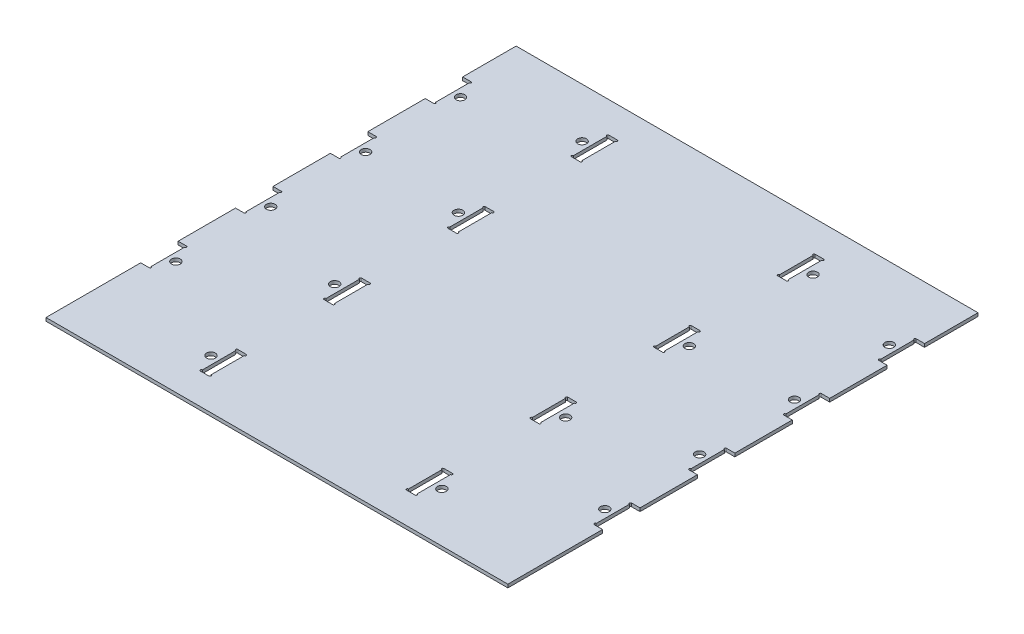
from build123d import *

# Parameters (mm, degrees)
SKETCH1_W               = 355.6
SKETCH1_H               = 361.95
BOSS_EXTRUDE1_DEPTH     = 2.54
F_1_4_CLEARANCE_HOLE1_D = 6.7564
SKETCH9_W               = 6.604
SKETCH9_H               = 28.829
SKETCH9_W_2             = 6.35
SKETCH9_H_2             = 28.575
CUT_EXTRUDE1_DEPTH      = 254.714883728
MIRROR1_OUTLINE_W       = 6.477
MIRROR1_OUTLINE_H       = 28.829
MIRROR1_OUTLINE_W_2     = 6.604
MIRROR1_OUTLINE_R       = 3.3782
MIRROR1_DEPTH           = 2.54
SKETCH10_R              = 0.79375
CUT_EXTRUDE2_DEPTH      = 254.714883728


# Read off the part's stored shape, not the designer's step: Mirror1
with BuildPart() as part:
    # Sketch1 → Boss-Extrude1 (new body)
    with BuildSketch(Plane(origin=(0, 0, 0), x_dir=(1, 0, 0), z_dir=(0, 1, 0))):
        Rectangle(SKETCH1_W, SKETCH1_H)
    extrude(amount=BOSS_EXTRUDE1_DEPTH)

    # 1/4 Clearance Hole1 (through all)
    with Locations(Plane(origin=(0, 2.54, 0), x_dir=(1, 0, 0), z_dir=(0, 1, 0))):
        with Locations((-165.1, 125.4125), (-88.9, 142.875), (-88.9, 47.625), (-165.1, 52.3875), (-165.1, -20.6375), (-88.9, -47.625), (-88.9, -142.875), (-165.1, -93.6625)):
            Hole(F_1_4_CLEARANCE_HOLE1_D / 2)

    # Sketch9 → Cut-Extrude1 (cut, through all)
    # profile 1 of 8: a face of its own
    with BuildSketch(Plane(origin=(0, 0, 0), x_dir=(-1, 0, 0), z_dir=(0, -1, 0))):
        with Locations((174.625, -93.6625)):
            Rectangle(SKETCH9_W, SKETCH9_H)
        with Locations((174.625, -93.6625)):
            Rectangle(SKETCH9_W_2, SKETCH9_H_2, mode=Mode.SUBTRACT)
    # profile 2 of 8: a face of its own
    with BuildSketch(Plane(origin=(0, 0, 0), x_dir=(-1, 0, 0), z_dir=(0, -1, 0))):
        with Locations((174.625, -20.6375)):
            Rectangle(SKETCH9_W, SKETCH9_H)
        with Locations((174.625, -20.6375)):
            Rectangle(SKETCH9_W_2, SKETCH9_H_2, mode=Mode.SUBTRACT)
    # profile 3 of 8: a face of its own
    with BuildSketch(Plane(origin=(0, 0, 0), x_dir=(-1, 0, 0), z_dir=(0, -1, 0))):
        with Locations((174.625, 52.3875)):
            Rectangle(SKETCH9_W, SKETCH9_H)
        with Locations((174.625, 52.3875)):
            Rectangle(SKETCH9_W_2, SKETCH9_H_2, mode=Mode.SUBTRACT)
    # profile 4 of 8: a face of its own
    with BuildSketch(Plane(origin=(0, 0, 0), x_dir=(-1, 0, 0), z_dir=(0, -1, 0))):
        with Locations((174.625, 125.4125)):
            Rectangle(SKETCH9_W, SKETCH9_H)
        with Locations((174.625, 125.4125)):
            Rectangle(SKETCH9_W_2, SKETCH9_H_2, mode=Mode.SUBTRACT)
    # profile 5 of 8: a face of its own
    with BuildSketch(Plane(origin=(0, 0, 0), x_dir=(-1, 0, 0), z_dir=(0, -1, 0))):
        with Locations((79.375, 142.875)):
            Rectangle(SKETCH9_W, SKETCH9_H)
        with Locations((79.375, 142.875)):
            Rectangle(SKETCH9_W_2, SKETCH9_H_2, mode=Mode.SUBTRACT)
    # profile 6 of 8: a face of its own
    with BuildSketch(Plane(origin=(0, 0, 0), x_dir=(-1, 0, 0), z_dir=(0, -1, 0))):
        with Locations((79.375, 47.625)):
            Rectangle(SKETCH9_W, SKETCH9_H)
        with Locations((79.375, 47.625)):
            Rectangle(SKETCH9_W_2, SKETCH9_H_2, mode=Mode.SUBTRACT)
    # profile 7 of 8: a face of its own
    with BuildSketch(Plane(origin=(0, 0, 0), x_dir=(-1, 0, 0), z_dir=(0, -1, 0))):
        with Locations((79.375, -47.625)):
            Rectangle(SKETCH9_W, SKETCH9_H)
        with Locations((79.375, -47.625)):
            Rectangle(SKETCH9_W_2, SKETCH9_H_2, mode=Mode.SUBTRACT)
    # profile 8 of 8: a face of its own
    with BuildSketch(Plane(origin=(0, 0, 0), x_dir=(-1, 0, 0), z_dir=(0, -1, 0))):
        with Locations((79.375, -142.875)):
            Rectangle(SKETCH9_W, SKETCH9_H)
        with Locations((79.375, -142.875)):
            Rectangle(SKETCH9_W_2, SKETCH9_H_2, mode=Mode.SUBTRACT)
    extrude(amount=-CUT_EXTRUDE1_DEPTH, mode=Mode.SUBTRACT)


with BuildPart() as cut_extrude1_kept_piece:
    # of the separate pieces the step leaves, the one the design keeps (cut_extrude1_pieces_kept)
    add(part.part.solids().sort_by_distance((-177.8, 0, -180.975))[0])

    # Mirror1 outline → Mirror1 (cut)
    with BuildSketch(Plane(origin=(0, 0, 0), x_dir=(1, 0, 0), z_dir=(0, 1, 0))):
        with Locations((174.5615, 125.4125)):
            Rectangle(MIRROR1_OUTLINE_W, MIRROR1_OUTLINE_H)
        with Locations((174.5615, 52.3875)):
            Rectangle(MIRROR1_OUTLINE_W, MIRROR1_OUTLINE_H)
        with Locations((174.5615, -20.6375)):
            Rectangle(MIRROR1_OUTLINE_W, MIRROR1_OUTLINE_H)
        with Locations((174.5615, -93.6625)):
            Rectangle(MIRROR1_OUTLINE_W, MIRROR1_OUTLINE_H)
        with Locations((79.375, 142.875)):
            Rectangle(MIRROR1_OUTLINE_W_2, MIRROR1_OUTLINE_H)
        with Locations((79.375, 47.625)):
            Rectangle(MIRROR1_OUTLINE_W_2, MIRROR1_OUTLINE_H)
        with Locations((79.375, -47.625)):
            Rectangle(MIRROR1_OUTLINE_W_2, MIRROR1_OUTLINE_H)
        with Locations((79.375, -142.875)):
            Rectangle(MIRROR1_OUTLINE_W_2, MIRROR1_OUTLINE_H)
        with Locations((165.1, -93.6625)):
            Circle(MIRROR1_OUTLINE_R)
        with Locations((88.9, -142.875)):
            Circle(MIRROR1_OUTLINE_R)
        with Locations((88.9, -47.625)):
            Circle(MIRROR1_OUTLINE_R)
        with Locations((165.1, -20.6375)):
            Circle(MIRROR1_OUTLINE_R)
        with Locations((165.1, 52.3875)):
            Circle(MIRROR1_OUTLINE_R)
        with Locations((88.9, 47.625)):
            Circle(MIRROR1_OUTLINE_R)
        with Locations((88.9, 142.875)):
            Circle(MIRROR1_OUTLINE_R)
        with Locations((165.1, 125.4125)):
            Circle(MIRROR1_OUTLINE_R)
    extrude(amount=MIRROR1_DEPTH, mode=Mode.SUBTRACT)

    # Sketch10 → Cut-Extrude2 (cut, through all)
    with BuildSketch(Plane(origin=(0, 2.54, 0), x_dir=(1, 0, 0), z_dir=(0, 1, 0))):
        with Locations((-171.323, 139.03325)):
            Circle(SKETCH10_R)
        with Locations((-171.323, 111.79175)):
            Circle(SKETCH10_R)
        with Locations((-171.323, 66.00825)):
            Circle(SKETCH10_R)
        with Locations((-171.323, 38.76675)):
            Circle(SKETCH10_R)
        with Locations((-82.677, 156.49575)):
            Circle(SKETCH10_R)
        with Locations((-76.073, 156.49575)):
            Circle(SKETCH10_R)
        with Locations((-76.073, 129.25425)):
            Circle(SKETCH10_R)
        with Locations((-82.677, 129.25425)):
            Circle(SKETCH10_R)
        with Locations((-82.677, 61.24575)):
            Circle(SKETCH10_R)
        with Locations((-76.073, 61.24575)):
            Circle(SKETCH10_R)
        with Locations((-76.073, 34.00425)):
            Circle(SKETCH10_R)
        with Locations((-82.677, 34.00425)):
            Circle(SKETCH10_R)
        with Locations((-171.323, -7.01675)):
            Circle(SKETCH10_R)
        with Locations((-171.323, -34.25825)):
            Circle(SKETCH10_R)
        with Locations((-82.677, -34.00425)):
            Circle(SKETCH10_R)
        with Locations((-76.073, -34.00425)):
            Circle(SKETCH10_R)
        with Locations((-76.073, -61.24575)):
            Circle(SKETCH10_R)
        with Locations((-82.677, -61.24575)):
            Circle(SKETCH10_R)
        with Locations((-171.323, -80.04175)):
            Circle(SKETCH10_R)
        with Locations((-171.323, -107.28325)):
            Circle(SKETCH10_R)
        with Locations((-82.677, -129.25425)):
            Circle(SKETCH10_R)
        with Locations((-76.073, -129.25425)):
            Circle(SKETCH10_R)
        with Locations((-76.073, -156.49575)):
            Circle(SKETCH10_R)
        with Locations((-82.677, -156.49575)):
            Circle(SKETCH10_R)
        with Locations((82.677, -156.49575)):
            Circle(SKETCH10_R)
        with Locations((76.073, -156.49575)):
            Circle(SKETCH10_R)
        with Locations((76.073, -129.25425)):
            Circle(SKETCH10_R)
        with Locations((82.677, -129.25425)):
            Circle(SKETCH10_R)
        with Locations((171.323, -107.28325)):
            Circle(SKETCH10_R)
        with Locations((171.323, -80.04175)):
            Circle(SKETCH10_R)
        with Locations((82.677, -61.24575)):
            Circle(SKETCH10_R)
        with Locations((76.073, -61.24575)):
            Circle(SKETCH10_R)
        with Locations((76.073, -34.00425)):
            Circle(SKETCH10_R)
        with Locations((82.677, -34.00425)):
            Circle(SKETCH10_R)
        with Locations((171.323, -34.25825)):
            Circle(SKETCH10_R)
        with Locations((171.323, -7.01675)):
            Circle(SKETCH10_R)
        with Locations((82.677, 34.00425)):
            Circle(SKETCH10_R)
        with Locations((76.073, 34.00425)):
            Circle(SKETCH10_R)
        with Locations((76.073, 61.24575)):
            Circle(SKETCH10_R)
        with Locations((82.677, 61.24575)):
            Circle(SKETCH10_R)
        with Locations((82.677, 129.25425)):
            Circle(SKETCH10_R)
        with Locations((76.073, 129.25425)):
            Circle(SKETCH10_R)
        with Locations((76.073, 156.49575)):
            Circle(SKETCH10_R)
        with Locations((82.677, 156.49575)):
            Circle(SKETCH10_R)
        with Locations((171.323, 38.76675)):
            Circle(SKETCH10_R)
        with Locations((171.323, 66.00825)):
            Circle(SKETCH10_R)
        with Locations((171.323, 111.79175)):
            Circle(SKETCH10_R)
        with Locations((171.323, 139.03325)):
            Circle(SKETCH10_R)
    extrude(amount=-CUT_EXTRUDE2_DEPTH, mode=Mode.SUBTRACT)


solid = cut_extrude1_kept_piece.part
